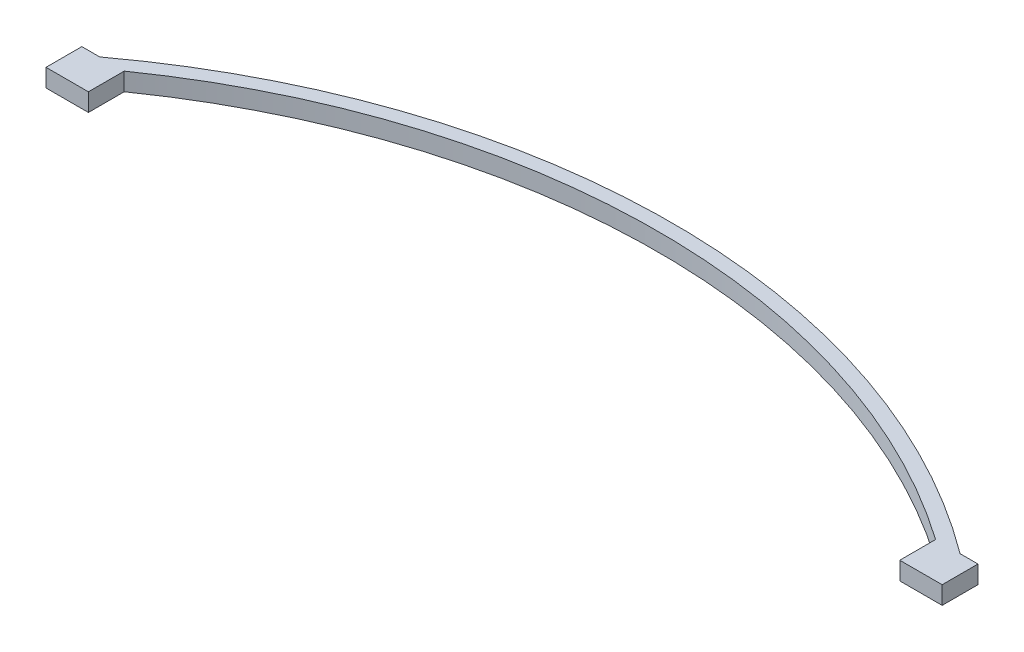
from build123d import *

# Parameters (mm, degrees)
BOSS_EXTRUDE2_DEPTH = 3.175
SKETCH2_W           = 7.510841938
SKETCH2_H           = 3.175
BOSS_EXTRUDE3_DEPTH = 6.35


with BuildPart() as part:
    # Sketch1 → Boss-Extrude2 (new body)
    with BuildSketch(Plane(origin=(0, 0, 0), x_dir=(1, 0, 0), z_dir=(0, 1, 0))):
        with BuildLine():
            Line((-76.2, 0), (-71.864158062, 0))
            ThreePointArc((-71.864158062, 0), (0, 22.7), (71.864158062, 0))
            Line((71.864158062, 0), (76.2, 0))
            ThreePointArc((76.2, 0), (0, 25.24), (-76.2, 0))
        make_face()
    extrude(amount=BOSS_EXTRUDE2_DEPTH)

    # Sketch2 → Boss-Extrude3 (add)
    with BuildSketch(Plane.XY):
        with Locations((-75.619579031, 1.5875)):
            Rectangle(SKETCH2_W, SKETCH2_H)
        with Locations((75.619579031, 1.5875)):
            Rectangle(SKETCH2_W, SKETCH2_H)
    extrude(amount=BOSS_EXTRUDE3_DEPTH)


solid = part.part
